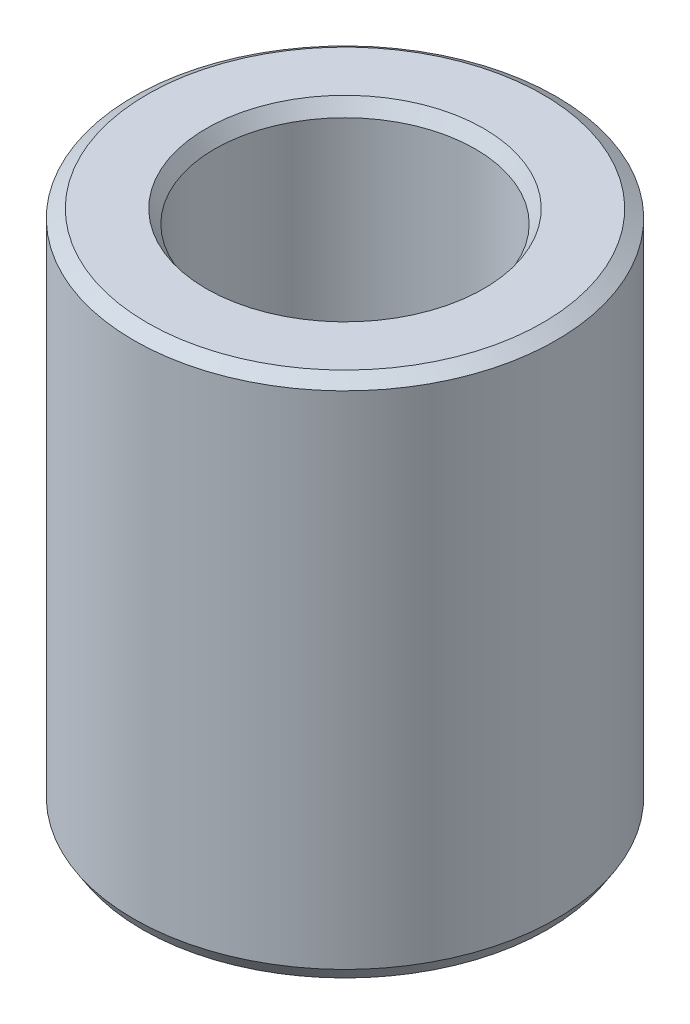
from build123d import *
from OCP.BRepFilletAPI import BRepFilletAPI_MakeChamfer

# Parameters (mm, degrees)
SKETCH1_R           = 32.5
BOSS_EXTRUDE1_DEPTH = 80.475214427
SKETCH2_R           = 20.042047053
CUT_EXTRUDE1_DEPTH  = 93.675563861
CHAMFER1_SIZE       = 1.311308233
CHAMFER1_SIZE2      = 2.06493357


with BuildPart() as part:
    # Sketch1 → Boss-Extrude1 (new body)
    with BuildSketch(Plane(origin=(0, 0, 0), x_dir=(1, 0, 0), z_dir=(0, 1, 0))):
        Circle(SKETCH1_R)
    extrude(amount=BOSS_EXTRUDE1_DEPTH)

    # Sketch2 → Cut-Extrude1 (cut, through all)
    with BuildSketch(Plane(origin=(0, 0, 0), x_dir=(1, 0, 0), z_dir=(0, 1, 0))):
        Circle(SKETCH2_R)
    extrude(amount=CUT_EXTRUDE1_DEPTH, mode=Mode.SUBTRACT)

    # Chamfer1: one chamfer whose edges measure the first distance from different faces: ONE call of the kernel's chamfer builder (chamfer() names one face for all edges)
    chamfer1_edges_1 = [part.edges().sort_by_distance(p)[0] for p in [
        (-20.042047053, 80.475214427, 0),
    ]]
    chamfer1_side_1 = [part.faces().sort_by_distance(p)[0] for p in [
        (-31.580761184, 80.475214427, 0),
    ]]
    chamfer1_edges_2 = [part.edges().sort_by_distance(p)[0] for p in [
        (-20.042047053, 0, 0),
    ]]
    chamfer1_side_2 = [part.faces().sort_by_distance(p)[0] for p in [
        (-20.042047053, 40.237607213, 0),
    ]]
    chamfer1_edges_3 = [part.edges().sort_by_distance(p)[0] for p in [
        (-32.5, 0, 0),
    ]]
    chamfer1_side_3 = [part.faces().sort_by_distance(p)[0] for p in [
        (-31.580761184, 0, 0),
    ]]
    chamfer1_edges_4 = [part.edges().sort_by_distance(p)[0] for p in [
        (-32.5, 80.475214427, 0),
    ]]
    chamfer1_side_4 = [part.faces().sort_by_distance(p)[0] for p in [
        (-32.5, 40.237607213, 0),
    ]]
    chamfer1 = BRepFilletAPI_MakeChamfer(part.part.solid().wrapped)
    for e in chamfer1_edges_1:
        chamfer1.Add(CHAMFER1_SIZE, CHAMFER1_SIZE2, e.wrapped, chamfer1_side_1[0].wrapped)  # the first distance lies on this face
    for e in chamfer1_edges_2:
        chamfer1.Add(CHAMFER1_SIZE, CHAMFER1_SIZE2, e.wrapped, chamfer1_side_2[0].wrapped)  # the first distance lies on this face
    for e in chamfer1_edges_3:
        chamfer1.Add(CHAMFER1_SIZE, CHAMFER1_SIZE2, e.wrapped, chamfer1_side_3[0].wrapped)  # the first distance lies on this face
    for e in chamfer1_edges_4:
        chamfer1.Add(CHAMFER1_SIZE, CHAMFER1_SIZE2, e.wrapped, chamfer1_side_4[0].wrapped)  # the first distance lies on this face
    add(Compound.cast(chamfer1.Shape()), mode=Mode.REPLACE)


solid = part.part
